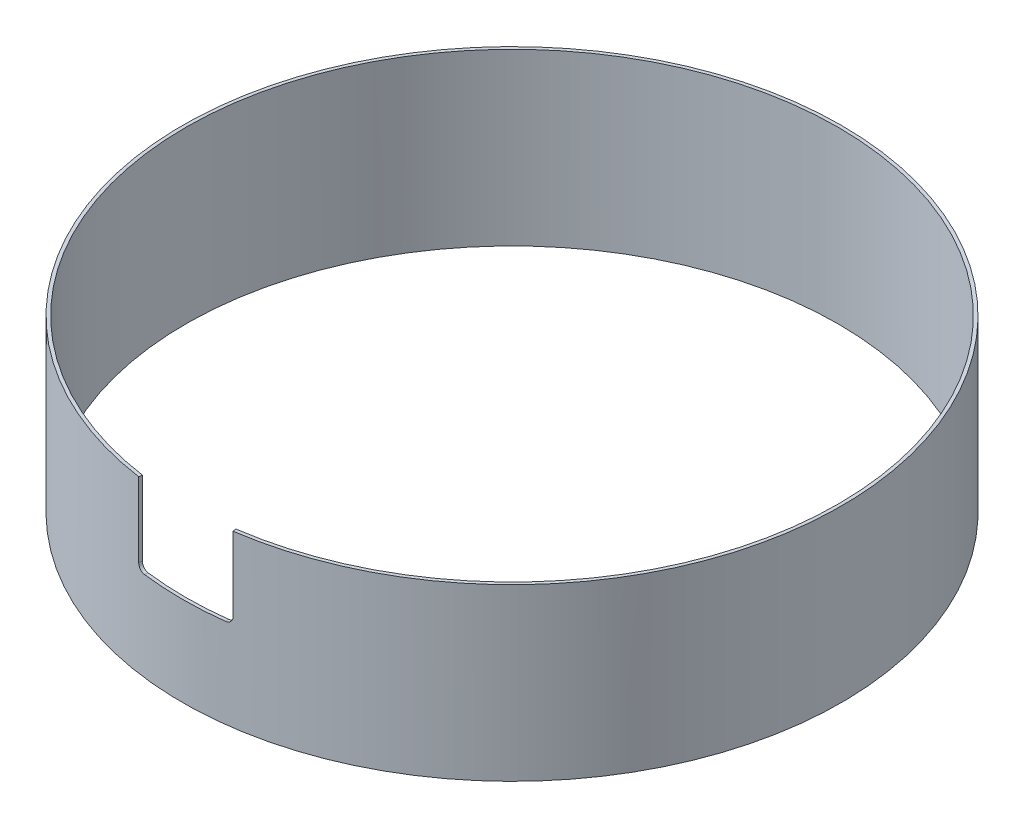
from build123d import *

# Parameters (mm, degrees)
SKETCH_1_R          = 50.300000000000004
SKETCH_1_R_2        = 49.8
EXTRUDE_1_DEPTH     = 24
CUT_EXTRUDE_START   = -12.35
CUT_EXTRUDE_2_DEPTH = 12.35
FILLET_3_R          = 1
EXTRUDE_START       = 2
SKETCH_4_R          = 50.300000000000004
SKETCH_4_R_2        = 49.79999999999999
EXTRUDE_2_DEPTH     = 2


with BuildPart() as part:
    # Эскиз1 → Бобышка-Вытянуть1 (new body)
    with BuildSketch(Plane(origin=(0, 0, 0), x_dir=(1, 0, 0), z_dir=(0, 1, 0))):
        Circle(SKETCH_1_R)
        Circle(SKETCH_1_R_2, mode=Mode.SUBTRACT)
    extrude(amount=EXTRUDE_1_DEPTH)

    # Эскиз3 → Вырез-Вытянуть2 (cut)
    with BuildSketch(Plane(origin=(0, 24, 0), x_dir=(1, 0, 0), z_dir=(0, 1, 0)).offset(CUT_EXTRUDE_START)):
        with BuildLine():
            Line((-7.128411632956304, -49.28717629963327), (-7.199269784197315, -49.776977439587135))
            Line((-7.199269784197315, -49.776977439587135), (-7.199999981887906, -49.782024871039695))
            ThreePointArc((-7.199999981887906, -49.782024871039695), (3.08e-15, -50.300000000000004), (7.199999981887906, -49.782024871039695))
            Line((7.199999981887906, -49.782024871039695), (7.199269784197315, -49.776977439587135))
            Line((7.199269784197315, -49.776977439587135), (7.128411632956304, -49.28717629963327))
            ThreePointArc((7.128411632956304, -49.28717629963327), (3.05e-15, -49.79999999999998), (-7.128411632956304, -49.28717629963327))
        make_face()
    extrude(amount=CUT_EXTRUDE_2_DEPTH, mode=Mode.SUBTRACT)

    # Скругление3
    fillet_3_edges = [part.edges().sort_by_distance(p)[0] for p in [
        (7.164205807422105, 11.65, 49.534600585336484),
        (-7.164205807422105, 11.65, 49.534600585336484),
    ]]
    fillet(fillet_3_edges, radius=FILLET_3_R)

    # Эскиз4 → Бобышка-Вытянуть2 (add)
    with BuildSketch(Plane.XZ.offset(EXTRUDE_START)):
        Circle(SKETCH_4_R)
        Circle(SKETCH_4_R_2, mode=Mode.SUBTRACT)
    extrude(amount=-EXTRUDE_2_DEPTH)


solid = part.part
